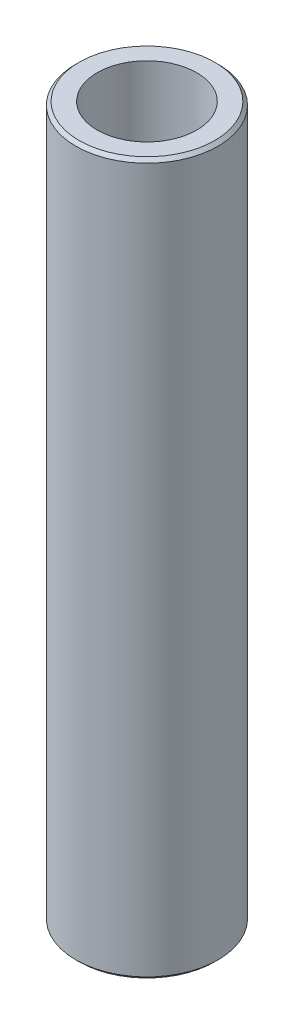
from build123d import *

# Parameters (mm, degrees)
SKETCH1_R           = 60
BOSS_EXTRUDE1_DEPTH = 600
SKETCH2_R           = 41.98001256
CUT_EXTRUDE1_DEPTH  = 606.970296302
CHAMFER1_SIZE       = 2.777549366


with BuildPart() as part:
    # Sketch1 → Boss-Extrude1 (new body)
    with BuildSketch(Plane(origin=(0, 0, 0), x_dir=(1, 0, 0), z_dir=(0, 1, 0))):
        Circle(SKETCH1_R)
    extrude(amount=BOSS_EXTRUDE1_DEPTH)

    # Sketch2 → Cut-Extrude1 (cut, through all)
    with BuildSketch(Plane(origin=(0, 0, 0), x_dir=(1, 0, 0), z_dir=(0, 1, 0))):
        Circle(SKETCH2_R)
    extrude(amount=CUT_EXTRUDE1_DEPTH, mode=Mode.SUBTRACT)

    # Chamfer1
    chamfer1_edges = [part.edges().sort_by_distance(p)[0] for p in [
        (-60, 600, 0),
        (-60, 0, 0),
    ]]
    chamfer(chamfer1_edges, length=CHAMFER1_SIZE)


solid = part.part
